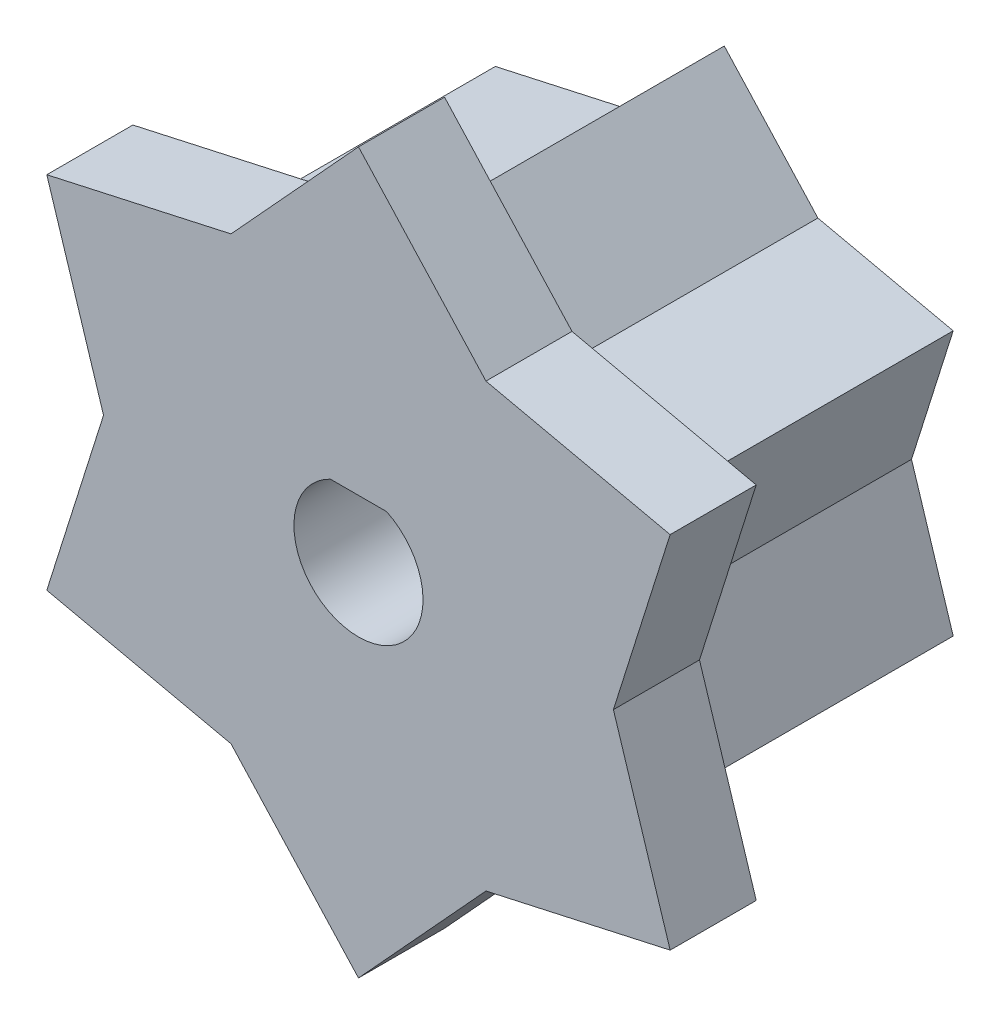
from build123d import *

# Parameters (mm, degrees)
BOSS_EXTRUDE1_DEPTH = 6.5
BOSS_EXTRUDE2_DEPTH = 2
CUT_EXTRUDE2_DEPTH  = 14.951569429
CHAMFER1_SIZE       = 0.4


with BuildPart() as part:
    # Sketch1 → Boss-Extrude1 (new body)
    with BuildSketch(Plane.XY):
        Polygon((2.175697935, 3.768419365), (0, 6.142777017), (-2.175697935, 3.768419365), (-5.319800946, 3.071388508), (-4.351395869, 0), (-5.319800946, -3.071388508), (-2.175697935, -3.768419365), (0, -6.142777017), (2.175697935, -3.768419365), (5.319800946, -3.071388508), (4.351395869, 0), (5.319800946, 3.071388508), align=None)
    extrude(amount=-BOSS_EXTRUDE1_DEPTH)

    # Sketch2 → Boss-Extrude2 (add)
    with BuildSketch(Plane.XY):
        Polygon((7.242620565, 4.181528933), (2.962094779, 5.130498653), (0, 8.363057866), (-2.962094779, 5.130498653), (-7.242620565, 4.181528933), (-5.924189557, 0), (-7.242620565, -4.181528933), (-2.962094779, -5.130498653), (0, -8.363057866), (2.962094779, -5.130498653), (7.242620565, -4.181528933), (5.924189557, 0), align=None)
    extrude(amount=BOSS_EXTRUDE2_DEPTH)

    # Sketch3 → Cut-Extrude2 (cut, through all)
    with BuildSketch(Plane.XY.offset(2)):
        with BuildLine():
            ThreePointArc((1.5, 0), (1.270974481, 0.796632832), (0.653834842, 1.35))
            Line((0.653834842, 1.35), (-0.653834842, 1.35))
            ThreePointArc((-0.653834842, 1.35), (-1.270974481, 0.796632832), (-1.5, 0))
            ThreePointArc((-1.5, 0), (0, -1.5), (1.5, 0))
        make_face()
    extrude(amount=-CUT_EXTRUDE2_DEPTH, mode=Mode.SUBTRACT)

    # Chamfer1
    chamfer1_edges = [part.edges().sort_by_distance(p)[0] for p in [
        (3.74774944, -3.419903937, 0),
        (1.087848967, -4.955598191, 0),
        (-1.087848967, -4.955598191, 0),
        (-3.74774944, -3.419903937, 0),
        (-4.835598408, -1.535694254, 0),
        (-4.835598408, 1.535694254, 0),
        (-3.74774944, 3.419903937, 0),
        (4.835598408, -1.535694254, 0),
        (4.835598408, 1.535694254, 0),
        (3.74774944, 3.419903937, 0),
        (1.087848967, 4.955598191, 0),
        (-1.087848967, 4.955598191, 0),
    ]]
    chamfer(chamfer1_edges, length=CHAMFER1_SIZE)


solid = part.part
